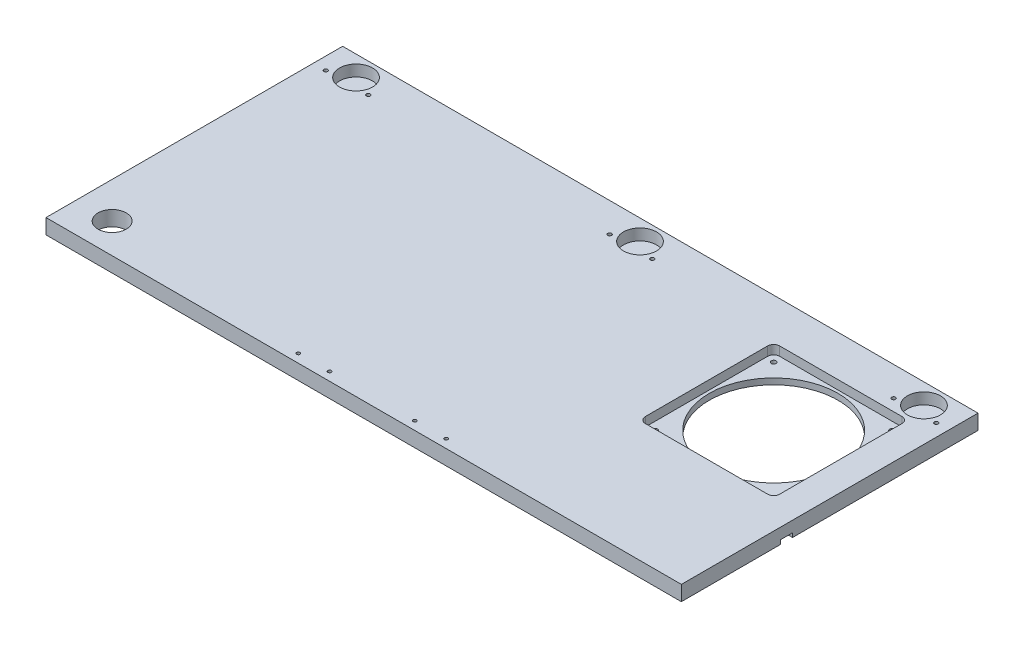
from build123d import *

# Parameters (mm, degrees)
SKETCH1_W               = 671.2712
SKETCH1_H               = 313.4106
BOSS_EXTRUDE1_DEPTH     = 15.875
CUT_EXTRUDE2_DEPTH      = 371.755745283
CUT_EXTRUDE2_DEPTH_BACK = 371.755745283
SKETCH4_R               = 14.9225
SKETCH5_R               = 17.4625
SKETCH5_R_2             = 2
CUT_EXTRUDE3_DEPTH      = 11.90625
SKETCH6_R               = 1.8
CUT_EXTRUDE4_DEPTH      = 2.54
CUT_EXTRUDE5_DEPTH      = 371.755745283
CUT_EXTRUDE5_DEPTH_BACK = 371.755745283
SKETCH7_R               = 68
SKETCH7_R_2             = 2.54
CUT_EXTRUDE6_DEPTH      = 9.525
SKETCH9_W               = 671.2712
SKETCH9_H               = 12.5
CUT_EXTRUDE7_DEPTH      = 4.35


with BuildPart() as part:
    # Sketch1 → Boss-Extrude1 (new body)
    with BuildSketch(Plane(origin=(0, 0, 0), x_dir=(1, 0, 0), z_dir=(0, 1, 0))):
        Rectangle(SKETCH1_W, SKETCH1_H)
    extrude(amount=BOSS_EXTRUDE1_DEPTH)

    # Sketch4 → Cut-Extrude2 (cut, two sides: drawn at the far end of the back side and taken through both)
    with BuildSketch(Plane(origin=(0, 15.875, 0), x_dir=(1, 0, 0), z_dir=(0, 1, 0)).offset(-CUT_EXTRUDE2_DEPTH_BACK)):
        with Locations((-297.5356, -124.9553)):
            Circle(SKETCH4_R)
    extrude(amount=CUT_EXTRUDE2_DEPTH + CUT_EXTRUDE2_DEPTH_BACK, mode=Mode.SUBTRACT)

    # Sketch5 → Cut-Extrude3 (cut)
    with BuildSketch(Plane(origin=(0, 15.875, 0), x_dir=(1, 0, 0), z_dir=(0, 1, 0))):
        with Locations((0, 135.2428)):
            Circle(SKETCH5_R)
        with Locations((22.5, 125.7428)):
            Circle(SKETCH5_R_2)
        with Locations((-22.5, 125.7428)):
            Circle(SKETCH5_R_2)
        with Locations((-300, 135.2428)):
            Circle(SKETCH5_R)
        with Locations((-277.5, 125.7428)):
            Circle(SKETCH5_R_2)
        with Locations((-322.5, 125.7428)):
            Circle(SKETCH5_R_2)
        with Locations((322.5, 125.7428)):
            Circle(SKETCH5_R_2)
        with Locations((277.5, 125.7428)):
            Circle(SKETCH5_R_2)
        with Locations((300, 135.2428)):
            Circle(SKETCH5_R)
    extrude(amount=-CUT_EXTRUDE3_DEPTH, mode=Mode.SUBTRACT)

    # Sketch6 → Cut-Extrude4 (cut)
    with BuildSketch(Plane(origin=(0, 15.875, 0), x_dir=(1, 0, 0), z_dir=(0, 1, 0))):
        with Locations((78.0499912, -147.7053)):
            Circle(SKETCH6_R)
        with Locations((45.0499912, -147.7053)):
            Circle(SKETCH6_R)
        with Locations((-45.0499912, -147.7053)):
            Circle(SKETCH6_R)
        with Locations((-78.0499912, -147.7053)):
            Circle(SKETCH6_R)
    extrude(amount=-CUT_EXTRUDE4_DEPTH, mode=Mode.SUBTRACT)

    # Sketch7 → Cut-Extrude5 (cut, two sides: drawn at the far end of the back side and taken through both)
    with BuildSketch(Plane(origin=(0, 15.875, 0), x_dir=(1, 0, 0), z_dir=(0, 1, 0)).offset(-CUT_EXTRUDE5_DEPTH_BACK)):
        with Locations((234.0356, 42.4053)):
            Circle(SKETCH7_R)
        with Locations((296.5356, -20.0947)):
            Circle(SKETCH7_R_2)
        with Locations((296.5356, 104.9053)):
            Circle(SKETCH7_R_2)
        with Locations((171.5356, 104.9053)):
            Circle(SKETCH7_R_2)
        with Locations((171.5356, -20.0947)):
            Circle(SKETCH7_R_2)
    extrude(amount=CUT_EXTRUDE5_DEPTH + CUT_EXTRUDE5_DEPTH_BACK, mode=Mode.SUBTRACT)

    # Sketch8 → Cut-Extrude6 (cut)
    with BuildSketch(Plane(origin=(0, 15.875, 0), x_dir=(1, 0, 0), z_dir=(0, 1, 0))):
        with BuildLine():
            Line((169.3856, -28.5947), (298.6856, -28.5947))
            ThreePointArc((298.6856, -28.5947), (303.175728061, -26.734828061), (305.0356, -22.2447))
            Line((305.0356, -22.2447), (305.0356, 107.0553))
            ThreePointArc((305.0356, 107.0553), (303.175728061, 111.545428061), (298.6856, 113.4053))
            Line((298.6856, 113.4053), (169.3856, 113.4053))
            ThreePointArc((169.3856, 113.4053), (164.895471939, 111.545428061), (163.0356, 107.0553))
            Line((163.0356, 107.0553), (163.0356, -22.2447))
            ThreePointArc((163.0356, -22.2447), (164.895471939, -26.734828061), (169.3856, -28.5947))
        make_face()
    extrude(amount=-CUT_EXTRUDE6_DEPTH, mode=Mode.SUBTRACT)

    # Sketch9 → Cut-Extrude7 (cut)
    with BuildSketch(Plane.XZ):
        with Locations((0, 45.4803)):
            Rectangle(SKETCH9_W, SKETCH9_H)
    extrude(amount=-CUT_EXTRUDE7_DEPTH, mode=Mode.SUBTRACT)


solid = part.part
